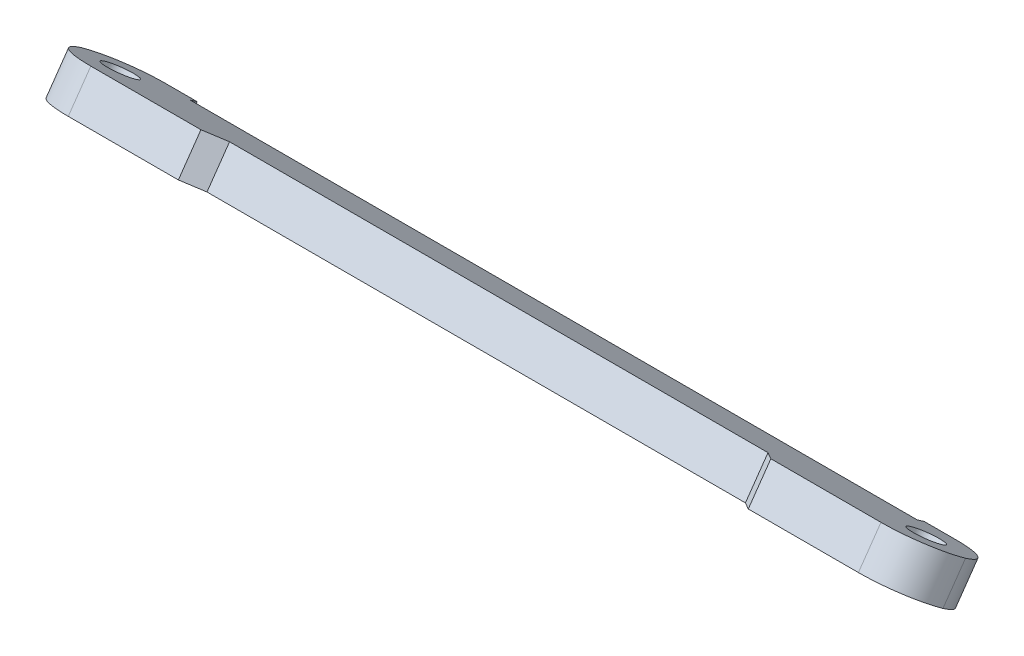
from build123d import *

# Parameters (mm, degrees)
SKETCH1_R             = 2
BOSS_EXTRUDE1_DEPTH   = 5
BOSS_EXTRUDE1_2_DEPTH = 5
SKETCH2_W             = 72.454585158
SKETCH2_H             = 8.503113073
BOSS_EXTRUDE2_DEPTH   = 5
CHAMFER1_SIZE         = 2
FILLET1_R             = 6


# Some blends are built 0.0001 mm under size
with BuildPart() as part:
    # Sketch1 → Boss-Extrude1 (new body)
    with BuildSketch(Plane(origin=(0, -2.867032155, 2.007517527), x_dir=(1, 0, 0), z_dir=(0, -0.8191520442889961, 0.5735764363510402))):
        Polygon((-56.227292579, -83.290902945), (-56.227292579, -94.897888962), (-46.227292579, -94.897888962), (-46.227292579, -93.794016018), (-36.227292579, -93.794016018), (-36.227292579, -83.290902945), align=None)
        with Locations(Location((-51.227292579, -89.094395953, 0), (0, 0, 270))):
            Circle(SKETCH1_R, mode=Mode.SUBTRACT)
    extrude(amount=BOSS_EXTRUDE1_DEPTH)



with BuildPart() as body_2:
    # Sketch1 → Boss-Extrude1 2 (new body)
    with BuildSketch(Plane(origin=(0, -2.867032155, 2.007517527), x_dir=(1, 0, 0), z_dir=(0, -0.8191520442889961, 0.5735764363510402))):
        Polygon((36.227292579, -83.290902945), (56.227292579, -83.290902945), (56.227292579, -94.897888962), (46.227292579, -94.897888962), (46.227292579, -93.794016018), (36.227292579, -93.794016018), align=None)
        with Locations(Location((51.227292579, -89.094395953, 0), (0, 0, 90))):
            Circle(SKETCH1_R, mode=Mode.SUBTRACT)
    extrude(amount=BOSS_EXTRUDE1_2_DEPTH)


with BuildPart() as part_1:
    add(part.part)

    add(body_2.part)  # Boss-Extrude2 merges body 2
    # Sketch2 → Boss-Extrude2 (add)
    with BuildSketch(Plane(origin=(0, -6.962792376, 4.875399709), x_dir=(1, 0, 0), z_dir=(0, -0.8191520442889959, 0.5735764363510404))):
        with Locations((0, -89.542459482)):
            Rectangle(SKETCH2_W, SKETCH2_H)
    extrude(amount=-BOSS_EXTRUDE2_DEPTH)

    # Chamfer1
    chamfer1_edges = [part_1.edges().sort_by_distance(p)[0] for p in [
        (36.227292579, -53.83576443, -66.424758888),
        (-36.227292579, -53.83576443, -66.424758888),
    ]]
    chamfer(chamfer1_edges, length=CHAMFER1_SIZE - 0.0001)  # a hair under: the kernel refuses the full size

    # Fillet1
    # the kernel refuses this fillet: 6 mm, written as the material it takes off along each edge
    with BuildSketch(Plane(origin=(56.227292579, -45.010944459, -84.33192876), x_dir=(1.184237892933516e-15, 0.5735764363510399, 0.819152044288996), z_dir=(0, -0.819152044288996, 0.57357643635104)), Plane(origin=(56.227292579, -38.353450782, -74.824042436), x_dir=(-1, 0, 0), z_dir=(0, -0.819152044288996, 0.57357643635104))) as fillet1_piece_1:
        with BuildLine():
            CenterArc((FILLET1_R, FILLET1_R), FILLET1_R, 180, 90)
            Line((0, FILLET1_R), (0, 0))
            Line((0, 0), (FILLET1_R, 0))
        make_face()
    extrude(amount=35, mode=Mode.SUBTRACT)
    with BuildSketch(Plane(origin=(-56.227292579, -38.353450782, -74.824042436), x_dir=(1, 0, 0), z_dir=(0, -0.819152044288996, 0.57357643635104)), Plane(origin=(-56.227292579, -45.010944459, -84.33192876), x_dir=(0, 0.57357643635104, 0.819152044288996), z_dir=(0, -0.819152044288996, 0.57357643635104))) as fillet1_piece_2:
        with BuildLine():
            CenterArc((FILLET1_R, -FILLET1_R), FILLET1_R, 90, 90)
            Line((0, -FILLET1_R), (0, 0))
            Line((0, 0), (FILLET1_R, 0))
        make_face()
    extrude(amount=35, mode=Mode.SUBTRACT)


solid = part_1.part
